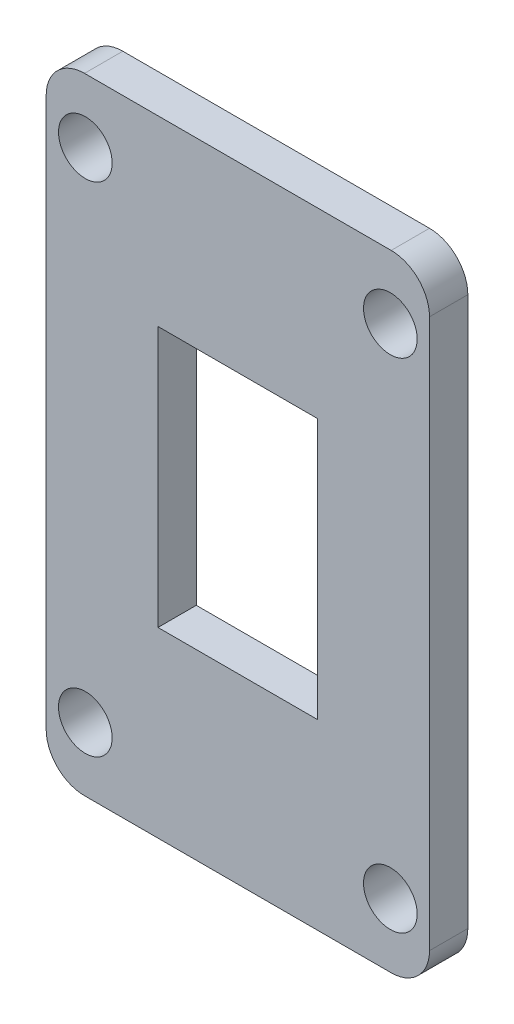
from build123d import *

# Parameters (mm, degrees)
SKETCH1_W           = 30
SKETCH1_H           = 48.96
SKETCH1_R           = 2.1
SKETCH1_W_2         = 12.5
SKETCH1_H_2         = 20.4
BOSS_EXTRUDE1_DEPTH = 3
FILLET1_R           = 3


with BuildPart() as part:
    # Sketch1 → Boss-Extrude1 (new body)
    with BuildSketch(Plane.XY):
        Rectangle(SKETCH1_W, SKETCH1_H)
        with Locations((-11.93627451, 19.48)):
            Circle(SKETCH1_R, mode=Mode.SUBTRACT)
        with Locations((11.93627451, 19.48)):
            Circle(SKETCH1_R, mode=Mode.SUBTRACT)
        with Locations((11.93627451, -19.48)):
            Circle(SKETCH1_R, mode=Mode.SUBTRACT)
        with Locations((-11.93627451, -19.48)):
            Circle(SKETCH1_R, mode=Mode.SUBTRACT)
        Rectangle(SKETCH1_W_2, SKETCH1_H_2, mode=Mode.SUBTRACT)
    extrude(amount=BOSS_EXTRUDE1_DEPTH)

    # Fillet1
    fillet1_edges = [part.edges().sort_by_distance(p)[0] for p in [
        (-15, 24.48, 1.5),
        (-15, -24.48, 1.5),
        (15, -24.48, 1.5),
        (15, 24.48, 1.5),
    ]]
    fillet(fillet1_edges, radius=FILLET1_R)


solid = part.part
